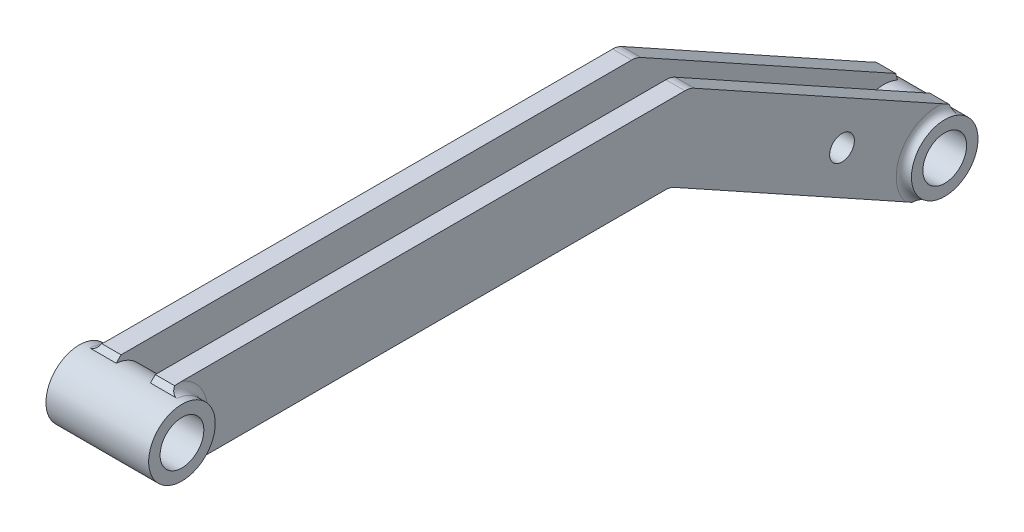
from build123d import *

# Parameters (mm, degrees)
DODANIE_WYCI_GNI_CIE1_DEPTH      = 10
DODANIE_WYCI_GNI_CIE2_DEPTH      = 8
DODANIE_WYCI_GNI_CIE2_DEPTH_BACK = 46
SZKIC2_R                         = 17.5
DODANIE_WYCI_GNI_CIE3_DEPTH      = 4
DODANIE_WYCI_GNI_CIE3_DEPTH_BACK = 42
SZKIC3_R                         = 17.5
WYTNIJ_WYCI_GNI_CIE1_REACH       = 438.69
SZKIC4_R                         = 11.5
WYTNIJ_WYCI_GNI_CIE2_REACH       = 438.213
SZKIC5_R                         = 11.5
ZAOKR_GLENIE1_R                  = 4
ZAOKR_GLENIE2_R                  = 10
SZKIC7_R                         = 6.5
WYTNIJ_WYCI_GNI_CIE3_DEPTH       = 436.773035366


with BuildPart() as part:
    # Szkic1 → Dodanie-wyciągnięcie1 (new body)
    with BuildSketch(Plane(origin=(0, 0, 0), x_dir=(0, 0, -1), z_dir=(1, 0, 0))):
        Polygon((0, 0), (271, 0), (407.197713576, -75.495625423), (408.756953924, -80.933342732), (393.243046076, -108.921173361), (387.805328767, -110.480413708), (260.655296626, -40), (0, -40), (-4, -36), (-4, -4), align=None)
    extrude(amount=DODANIE_WYCI_GNI_CIE1_DEPTH)


with BuildPart() as body_2:
    # Lustro3: mirrored copy
    add(part.part.mirror(Plane.ZY.offset(9)))


with BuildPart() as part_1:
    add(part.part)

    add(body_2.part)  # Dodanie-wyciągnięcie2 merges body 2
    # Szkic2 → Dodanie-wyciągnięcie2 (add, two sides: drawn at the far end of the back side and taken through both)
    with BuildSketch(Plane(origin=(10, 0, 0), x_dir=(0, 0, -1), z_dir=(1, 0, 0)).offset(-DODANIE_WYCI_GNI_CIE2_DEPTH_BACK)):
        with Locations((-4, -20)):
            Circle(SZKIC2_R)
    extrude(amount=DODANIE_WYCI_GNI_CIE2_DEPTH + DODANIE_WYCI_GNI_CIE2_DEPTH_BACK)

    # Szkic3 → Dodanie-wyciągnięcie3 (add, two sides: drawn at the far end of the back side and taken through both)
    with BuildSketch(Plane(origin=(10, 0, 0), x_dir=(0, 0, -1), z_dir=(1, 0, 0)).offset(-DODANIE_WYCI_GNI_CIE3_DEPTH_BACK)):
        with Locations((401, -94.927258046)):
            Circle(SZKIC3_R)
    extrude(amount=DODANIE_WYCI_GNI_CIE3_DEPTH + DODANIE_WYCI_GNI_CIE3_DEPTH_BACK)

    # Szkic4 → Wytnij-wyciągnięcie1 (cut, up to next)
    with BuildSketch(Plane(origin=(18, 0, 0), x_dir=(0, 0, -1), z_dir=(1, 0, 0)), mode=Mode.PRIVATE) as wytnij_wyci_gni_cie1_sk1:
        with Locations((-4, -20)):
            Circle(SZKIC4_R)
    wytnij_wyci_gni_cie1_tool1 = extrude(wytnij_wyci_gni_cie1_sk1.sketch, amount=-WYTNIJ_WYCI_GNI_CIE1_REACH, mode=Mode.PRIVATE) & part_1.part
    add(wytnij_wyci_gni_cie1_tool1.solids().sort_by_distance((18, -20, 4))[0], mode=Mode.SUBTRACT)

    # Szkic5 → Wytnij-wyciągnięcie2 (cut, up to next)
    with BuildSketch(Plane(origin=(14, 0, 0), x_dir=(0, 0, -1), z_dir=(1, 0, 0)), mode=Mode.PRIVATE) as wytnij_wyci_gni_cie2_sk1:
        with Locations((401, -94.927258046)):
            Circle(SZKIC5_R)
    wytnij_wyci_gni_cie2_tool1 = extrude(wytnij_wyci_gni_cie2_sk1.sketch, amount=-WYTNIJ_WYCI_GNI_CIE2_REACH, mode=Mode.PRIVATE) & part_1.part
    add(wytnij_wyci_gni_cie2_tool1.solids().sort_by_distance((14, -94.927258, -401))[0], mode=Mode.SUBTRACT)

    # Zaokrąglenie1
    # the kernel refuses this fillet: 4 mm, written as the material it adds along each edge
    with BuildSketch(Plane(origin=(-28, -94.927258046, -401), x_dir=(0, 0.5436759874947165, -0.8392951927788249), z_dir=(0, -0.8392951927788249, -0.5436759874947165))) as zaokr_glenie1_piece_1_section:
        with BuildLine():
            CenterArc((17.5 + ZAOKR_GLENIE1_R, -ZAOKR_GLENIE1_R), ZAOKR_GLENIE1_R, 90, 90)
            Line((17.5 + ZAOKR_GLENIE1_R, 0), (17.5, 0))
            Line((17.5, 0), (17.5, -ZAOKR_GLENIE1_R))
        make_face()
    zaokr_glenie1_piece_1 = revolve(axis=Axis((-28, -94.927258046, -401), (1, 0, 0)), revolution_arc=236.131536778, mode=Mode.PRIVATE)
    zaokr_glenie1_piece_1 = split(zaokr_glenie1_piece_1, bisect_by=Plane(origin=(-29.129078487, -79.146319532, -408.244533267), z_dir=(0, -0.27563735581700194, 0.9612616959383181)), keep=Keep.TOP, mode=Mode.PRIVATE)
    zaokr_glenie1_piece_1 = split(zaokr_glenie1_piece_1, bisect_by=Plane(origin=(-29.129078487, -109.433594017, -391.456022876), z_dir=(0, 0.961261695938321, 0.2756373558169916)), keep=Keep.TOP, mode=Mode.PRIVATE)
    zaokr_glenie1_piece_1 = split(zaokr_glenie1_piece_1, bisect_by=Plane(origin=(-29.129078487, -103.388095722, -375.010448424), z_dir=(0, 0.8746197071393952, -0.4848096202463382)), keep=Keep.TOP, mode=Mode.PRIVATE)
    zaokr_glenie1_piece_1 = split(zaokr_glenie1_piece_1, bisect_by=Plane(origin=(-29.129078487, -68.403307437, -394.402833234), z_dir=(0, -0.8746197071393943, 0.4848096202463399)), keep=Keep.TOP, mode=Mode.PRIVATE)
    add(zaokr_glenie1_piece_1)
    with BuildSketch(Plane(origin=(-28, -20, 4), x_dir=(0, -0.8826991233352643, 0.469938567967299), z_dir=(0, 0.469938567967299, 0.8826991233352643))) as zaokr_glenie1_piece_2_section:
        with BuildLine():
            CenterArc((17.5 + ZAOKR_GLENIE1_R, -ZAOKR_GLENIE1_R), ZAOKR_GLENIE1_R, 90, 90)
            Line((17.5 + ZAOKR_GLENIE1_R, 0), (17.5, 0))
            Line((17.5, 0), (17.5, -ZAOKR_GLENIE1_R))
        make_face()
    zaokr_glenie1_piece_2 = revolve(axis=Axis((-28, -20, 4), (1, 0, 0)), revolution_arc=118.030308923, mode=Mode.PRIVATE)
    zaokr_glenie1_piece_2 = split(zaokr_glenie1_piece_2, bisect_by=Plane(origin=(-29.137845044, -41.167759306, -1.167759306), z_dir=(0, 0.7071067811865419, -0.7071067811865531)), keep=Keep.TOP, mode=Mode.PRIVATE)
    zaokr_glenie1_piece_2 = split(zaokr_glenie1_piece_2, bisect_by=Plane(origin=(-29.137845044, -40, -9.710667039), z_dir=(0, 1, 0)), keep=Keep.TOP, mode=Mode.PRIVATE)
    add(zaokr_glenie1_piece_2)
    with BuildSketch(Plane(origin=(10, -20, 4), x_dir=(0, -0.8826991233352602, 0.46993856796730693), z_dir=(0, 0.46993856796730693, 0.8826991233352602))) as zaokr_glenie1_piece_3_section:
        with BuildLine():
            CenterArc((17.5 + ZAOKR_GLENIE1_R, ZAOKR_GLENIE1_R), ZAOKR_GLENIE1_R, 180, 90)
            Line((17.5, ZAOKR_GLENIE1_R), (17.5, 0))
            Line((17.5, 0), (17.5 + ZAOKR_GLENIE1_R, 0))
        make_face()
    zaokr_glenie1_piece_3 = revolve(axis=Axis((10, -20, 4), (1, 0, 0)), revolution_arc=118.030308923, mode=Mode.PRIVATE)
    zaokr_glenie1_piece_3 = split(zaokr_glenie1_piece_3, bisect_by=Plane(origin=(11.137845044, -41.167759305, -1.167759305), z_dir=(0, 0.7071067811865419, -0.7071067811865531)), keep=Keep.TOP, mode=Mode.PRIVATE)
    zaokr_glenie1_piece_3 = split(zaokr_glenie1_piece_3, bisect_by=Plane(origin=(11.137845044, -40, -9.710667039), z_dir=(0, 1, 0)), keep=Keep.TOP, mode=Mode.PRIVATE)
    add(zaokr_glenie1_piece_3)
    with BuildSketch(Plane(origin=(10, -94.927258046, -401), x_dir=(0, 0.5436759874947362, -0.8392951927788123), z_dir=(0, -0.8392951927788123, -0.5436759874947362))) as zaokr_glenie1_piece_4_section:
        with BuildLine():
            CenterArc((17.5 + ZAOKR_GLENIE1_R, ZAOKR_GLENIE1_R), ZAOKR_GLENIE1_R, 180, 90)
            Line((17.5, ZAOKR_GLENIE1_R), (17.5, 0))
            Line((17.5, 0), (17.5 + ZAOKR_GLENIE1_R, 0))
        make_face()
    zaokr_glenie1_piece_4 = revolve(axis=Axis((10, -94.927258046, -401), (1, 0, 0)), revolution_arc=236.131536778, mode=Mode.PRIVATE)
    zaokr_glenie1_piece_4 = split(zaokr_glenie1_piece_4, bisect_by=Plane(origin=(11.12907849, -68.403307435, -394.402833232), z_dir=(0, -0.8746197071393943, 0.4848096202463399)), keep=Keep.TOP, mode=Mode.PRIVATE)
    zaokr_glenie1_piece_4 = split(zaokr_glenie1_piece_4, bisect_by=Plane(origin=(11.12907849, -103.388095721, -375.010448422), z_dir=(0, 0.8746197071393952, -0.4848096202463382)), keep=Keep.TOP, mode=Mode.PRIVATE)
    zaokr_glenie1_piece_4 = split(zaokr_glenie1_piece_4, bisect_by=Plane(origin=(11.12907849, -109.433594018, -391.456022874), z_dir=(0, 0.961261695938321, 0.2756373558169916)), keep=Keep.TOP, mode=Mode.PRIVATE)
    zaokr_glenie1_piece_4 = split(zaokr_glenie1_piece_4, bisect_by=Plane(origin=(11.12907849, -79.14631953, -408.244533267), z_dir=(0, -0.27563735581700194, 0.9612616959383181)), keep=Keep.TOP, mode=Mode.PRIVATE)
    add(zaokr_glenie1_piece_4)
    with BuildSketch(Plane(origin=(10, -20, 4), x_dir=(0, 0, -1), z_dir=(0, -1, 0))) as zaokr_glenie1_piece_5_section:
        with BuildLine():
            CenterArc((17.5 + ZAOKR_GLENIE1_R, ZAOKR_GLENIE1_R), ZAOKR_GLENIE1_R, 180, 90)
            Line((17.5, ZAOKR_GLENIE1_R), (17.5, 0))
            Line((17.5, 0), (17.5 + ZAOKR_GLENIE1_R, 0))
        make_face()
    zaokr_glenie1_piece_5 = revolve(axis=Axis((10, -20, 4), (1, 0, 0)), revolution_arc=118.030308923, mode=Mode.PRIVATE)
    zaokr_glenie1_piece_5 = split(zaokr_glenie1_piece_5, bisect_by=Plane(origin=(11.137845049, 0, -9.710667043), z_dir=(0, -1, 0)), keep=Keep.TOP, mode=Mode.PRIVATE)
    zaokr_glenie1_piece_5 = split(zaokr_glenie1_piece_5, bisect_by=Plane(origin=(11.137845049, 1.167759309, -1.167759309), z_dir=(0, -0.7071067811865533, -0.7071067811865418)), keep=Keep.TOP, mode=Mode.PRIVATE)
    add(zaokr_glenie1_piece_5)
    with BuildSketch(Plane(origin=(-28, -20, 4), x_dir=(0, 0, -1), z_dir=(0, -1, 0))) as zaokr_glenie1_piece_6_section:
        with BuildLine():
            CenterArc((17.5 + ZAOKR_GLENIE1_R, -ZAOKR_GLENIE1_R), ZAOKR_GLENIE1_R, 90, 90)
            Line((17.5 + ZAOKR_GLENIE1_R, 0), (17.5, 0))
            Line((17.5, 0), (17.5, -ZAOKR_GLENIE1_R))
        make_face()
    zaokr_glenie1_piece_6 = revolve(axis=Axis((-28, -20, 4), (1, 0, 0)), revolution_arc=118.030308923, mode=Mode.PRIVATE)
    zaokr_glenie1_piece_6 = split(zaokr_glenie1_piece_6, bisect_by=Plane(origin=(-29.137845048, 1.167759309, -1.167759309), z_dir=(0, -0.7071067811865533, -0.7071067811865418)), keep=Keep.TOP, mode=Mode.PRIVATE)
    zaokr_glenie1_piece_6 = split(zaokr_glenie1_piece_6, bisect_by=Plane(origin=(-29.137845048, 0, -9.710667042), z_dir=(0, -1, 0)), keep=Keep.TOP, mode=Mode.PRIVATE)
    add(zaokr_glenie1_piece_6)

    # Zaokrąglenie2
    zaokr_glenie2_edges = [part_1.edges().sort_by_distance(p)[0] for p in [
        (5, 0, -271),
        (5, -40, -260.655296626),
        (-23, -40, -260.655296626),
        (-23, 0, -271),
    ]]
    fillet(zaokr_glenie2_edges, radius=ZAOKR_GLENIE2_R)

    # Szkic7 → Wytnij-wyciągnięcie3 (cut, through all)
    with BuildSketch(Plane(origin=(10, 0, 0), x_dir=(0, 0, -1), z_dir=(1, 0, 0))):
        with Locations(Location((351, -67.211805474, 0), (0, 0, 180))):
            Circle(SZKIC7_R)
    extrude(amount=-WYTNIJ_WYCI_GNI_CIE3_DEPTH, mode=Mode.SUBTRACT)


solid = part_1.part
